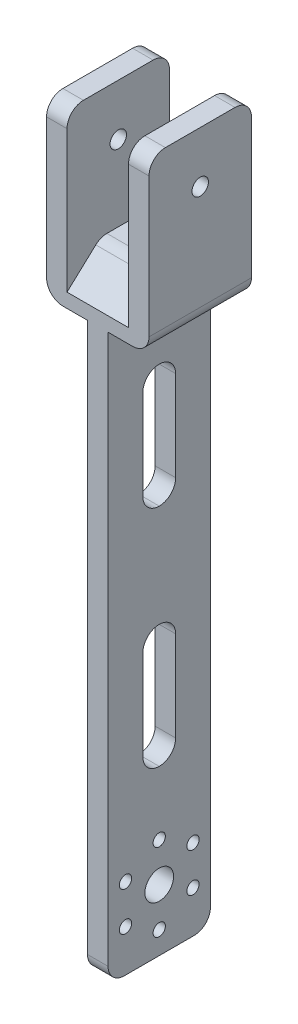
from build123d import *

# Parameters (mm, degrees)
Y_KSEKLIK_EKSTR_ZYON1_DEPTH = 25
IZIM2_R                     = 2
KES_EKSTR_ZYON1_DEPTH       = 25
IZIM3_R                     = 3.5
IZIM3_W                     = 8
IZIM3_H                     = 30
KES_EKSTR_ZYON2_DEPTH       = 10
IZIM4_R                     = 1.5
KES_EKSTR_ZYON3_DEPTH       = 10
DAIRESEL_KAPLAMA2_COUNT     = 6
CUT_EXTRUDE8_DEPTH          = 7.5
RADYUS1_R                   = 4


with BuildPart() as part:
    # Çizim1 → Yükseklik-Ekstrüzyon1 (new body)
    with BuildSketch(Plane.XY):
        Polygon((-2.5, 69), (-12.5, 69), (-12.5, 111), (-7.5, 111), (-7.5, 80), (7.5, 80), (7.5, 111), (12.5, 111), (12.5, 69), (2.5, 69), (2.5, -69), (-2.5, -69), align=None)
    extrude(amount=Y_KSEKLIK_EKSTR_ZYON1_DEPTH)

    # Çizim2 → Kes-Ekstrüzyon1 (cut)
    with BuildSketch(Plane.ZY.offset(12.5)):
        with Locations((12.5, 98.5)):
            Circle(IZIM2_R)
    extrude(amount=-KES_EKSTR_ZYON1_DEPTH, mode=Mode.SUBTRACT)

    # Çizim3 → Kes-Ekstrüzyon2 (cut)
    with BuildSketch(Plane.ZY.offset(2.5)):
        with Locations((12.5, -54)):
            Circle(IZIM3_R)
        with Locations((12.5, 41)):
            Rectangle(IZIM3_W, IZIM3_H)
        with Locations((12.5, -14)):
            Rectangle(IZIM3_W, IZIM3_H)
    extrude(amount=-KES_EKSTR_ZYON2_DEPTH, mode=Mode.SUBTRACT)

    # Çizim4 → Kes-Ekstrüzyon3 (cut)
    with BuildSketch(Plane.ZY.offset(2.5)):
        with Locations((12.5, -44.5)):
            Circle(IZIM4_R)
    kes_ekstr_zyon3 = extrude(amount=-KES_EKSTR_ZYON3_DEPTH, mode=Mode.SUBTRACT)

    # Dairesel Kaplama2: Kes-Ekstrüzyon3 ×6 about axis
    dairesel_kaplama2_axis = Axis((0, -54, 12.5), (1, 0, 0))
    for i in range(1, DAIRESEL_KAPLAMA2_COUNT):
        add(kes_ekstr_zyon3.rotate(dairesel_kaplama2_axis, i * 360 / DAIRESEL_KAPLAMA2_COUNT), mode=Mode.SUBTRACT)

    # Sketch2 → Cut-Extrude8 (cut, symmetric)
    with BuildSketch(Plane(origin=(0, 0, 0), x_dir=(0, 0, -1), z_dir=(1, 0, 0))):
        Polygon((-12.5, 84), (-25.5, 72), (-25.5, 86), (0.5, 86), (0.5, 72), align=None)
    extrude(amount=CUT_EXTRUDE8_DEPTH, both=True, mode=Mode.SUBTRACT)

    # Radyus1
    radyus1_edges = [part.edges().sort_by_distance(p)[0] for p in [
        (-10, 111, 25),
        (10, 111, 25),
        (10, 111, 0),
        (-10, 111, 0),
        (0, 26, 16.5),
        (0, 56, 16.5),
        (0, 26, 8.5),
        (0, 56, 8.5),
        (0, -29, 16.5),
        (0, -29, 8.5),
        (0, 1, 16.5),
        (0, 1, 8.5),
        (0, -69, 25),
        (0, -69, 0),
        (0, 80, 16.833333333),
        (0, 80, 8.166666667),
        (12.5, 69, 12.5),
        (-12.5, 69, 12.5),
    ]]
    fillet(radyus1_edges, radius=RADYUS1_R - 0.0001)  # a hair under: the kernel refuses the full size


solid = part.part
